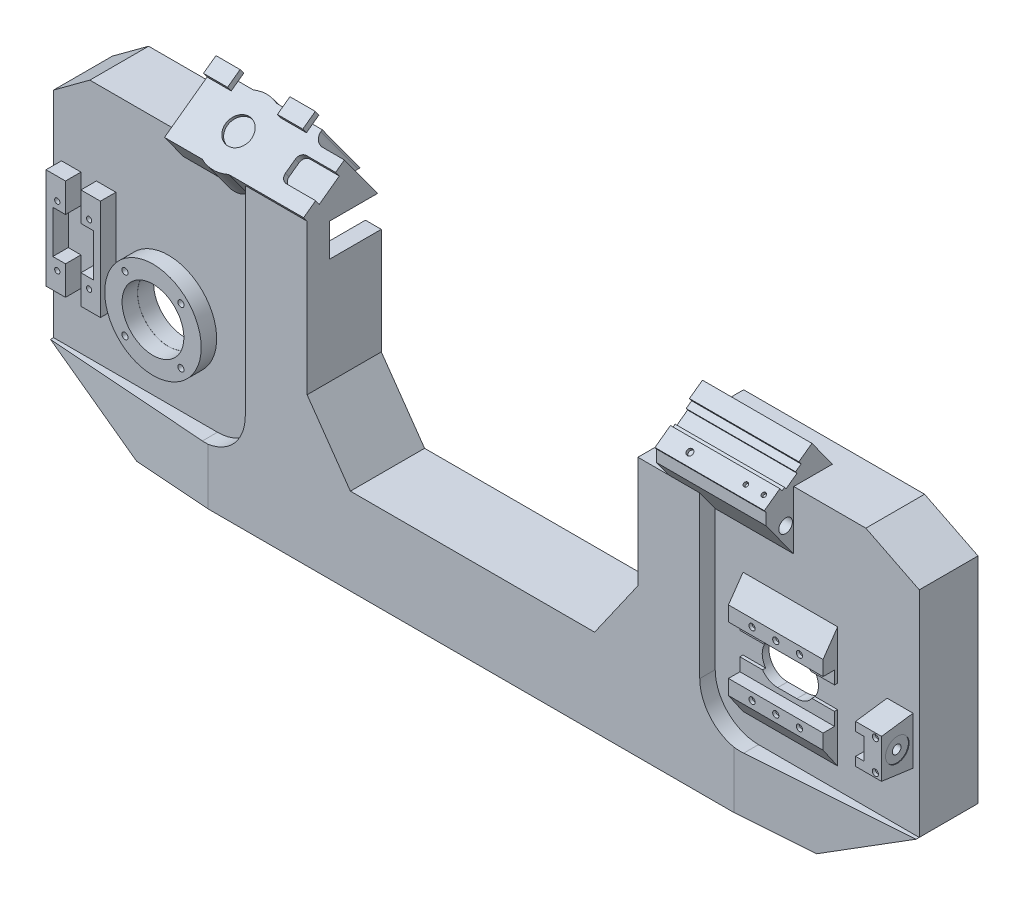
from build123d import *

# Parameters (mm, degrees)
ESQUISSE1_W                    = 1400
ESQUISSE1_H                    = 480
BOSS_EXTRU_1_DEPTH             = 95
ESQUISSE2_R                    = 78
ESQUISSE2_R_2                  = 50
BOSS_EXTRU_2_DEPTH             = 25
ESQUISSE4_R                    = 49.845
ENL_V_MAT_EXTRU_2_DEPTH        = 747.073052723
BOSS_EXTRU_3_DEPTH             = 25
CONG_1_R                       = 70
BOSS_EXTRU_4_DEPTH             = 25
ENL_V_MAT_EXTRU_5_DEPTH        = 748.063167972
ESQUISSE12_OUTSIDE_W           = 1699.17
ESQUISSE12_OUTSIDE_H           = 419.17
ENL_V_MAT_EXTRU_6_DEPTH        = 140
ENL_V_MAT_EXTRU_11_DEPTH       = 150
ESQUISSE14_W                   = 51
ESQUISSE14_H                   = 60
ENL_V_MAT_EXTRU_12_DEPTH       = 748.063167972
BOSS_EXTRU_18_START            = 415
BOSS_EXTRU_18_DEPTH            = 153
ESQUISSE31_W                   = 177
ESQUISSE31_H                   = 114
BOSS_EXTRU_19_DEPTH            = 150
ENL_V_MAT_EXTRU_19_DEPTH       = 207
ESQUISSE35_R                   = 11
ENL_V_MAT_EXTRU_20_DEPTH       = 87
ESQUISSE38_W                   = 225
ESQUISSE38_H                   = 99
BOSS_EXTRU_20_DEPTH            = 157
ESQUISSE39_W                   = 57
ESQUISSE39_H                   = 40
ENL_V_MAT_EXTRU_21_DEPTH       = 10
CONG_3_R                       = 10
ESQUISSE40_R                   = 53.5
BOSS_EXTRU_21_DEPTH            = 80
ESQUISSE42_R                   = 21
ENL_V_MAT_EXTRU_22_DEPTH       = 5
ESQUISSE43_W                   = 39
ESQUISSE43_H                   = 25
ESQUISSE43_W_2                 = 41
BOSS_EXTRU_22_DEPTH            = 10
ESQUISSE44_W                   = 50
ESQUISSE44_H                   = 17.5
ENL_V_MAT_EXTRU_23_DEPTH       = 183
CONG_4_R                       = 15
BOSS_EXTRU_23_START            = 690
BOSS_EXTRU_23_DEPTH            = 42
ENL_V_MAT_EXTRU_24_DEPTH       = 786.292239047
ENL_V_MAT_EXTRU_24_DEPTH_BACK  = 786.292239047
ENL_V_MAT_EXTRU_25_DEPTH       = 790.412383168
ENL_V_MAT_EXTRU_25_DEPTH_BACK  = 790.412383168
ESQUISSE87_R                   = 4.25
ESQUISSE87_R_2                 = 5
ESQUISSE89_R                   = 10.5
ENL_V_MAT_EXTRU_26_DEPTH       = 14
ESQUISSE90_R                   = 7
ENL_V_MAT_EXTRU_27_DEPTH       = 13
ESQUISSE93_W                   = 13.39
ESQUISSE93_H                   = 34.8
ENL_V_MAT_EXTRU_28_DEPTH       = 51
ESQUISSE94_R                   = 19
ENL_V_MAT_EXTRU_30_DEPTH       = 1
ESQUISSE96_R                   = 7
ENL_V_MAT_EXTRU_31_DEPTH       = 51
ENL_V_START                    = -84
ENL_V_MAT_EXTRU_32_OUTLINE_R   = 49.845
ENL_V_MAT_EXTRU_32_OUTLINE_R_2 = 5
ENL_V_MAT_EXTRU_32_OUTLINE_R_3 = 4.25
ENL_V_MAT_EXTRU_32_DEPTH       = 130.745344737
ESQUISSE122_W                  = 327.594526889
ESQUISSE122_H                  = 234.825077034
ESQUISSE122_R                  = 10.5
BOSS_EXTRU_25_DEPTH            = 15
ESQUISSE123_R                  = 49.845
ENL_V_MAT_EXTRU_33_DEPTH       = 781.359248616
ENL_V_MAT_EXTRU_34_DEPTH       = 15
ESQUISSE127_W                  = 45.95991567
ESQUISSE127_H                  = 52.348834678
ENL_V_MAT_EXTRU_36_DEPTH       = 1445.535877266
ESQUISSE36_R                   = 5
ESQUISSE36_R_2                 = 3.5
ENL_V_MAT_EXTRU_37_DEPTH       = 5
ESQUISSE128_R                  = 5
ENL_V_MAT_EXTRU_38_DEPTH       = 5
ESQUISSE129_R                  = 5
ENL_V_MAT_EXTRU_39_DEPTH       = 5


# Read off the part's stored shape, not the designer's step: Enlèv. mat.-Extru.32
with BuildPart() as part:
    # Esquisse1 → Boss.-Extru.1 (new body)
    with BuildSketch(Plane.XY):
        Rectangle(ESQUISSE1_W, ESQUISSE1_H)
    extrude(amount=BOSS_EXTRU_1_DEPTH)

    # Esquisse2 → Boss.-Extru.2 (add)
    with BuildSketch(Plane.XY.offset(95)):
        with Locations(Location((-514.266451246, -19.59, 0), (0, 0, 180))):
            Circle(ESQUISSE2_R)
        with Locations((-514.266451246, -19.59)):
            Circle(ESQUISSE2_R_2, mode=Mode.SUBTRACT)
    extrude(amount=BOSS_EXTRU_2_DEPTH)

    # Esquisse4 → Enlèv. mat.-Extru.2 (cut, through all)
    with BuildSketch(Plane.XY.offset(95)):
        with Locations((-514.266451246, -19.59)):
            Circle(ESQUISSE4_R)
    extrude(amount=-ENL_V_MAT_EXTRU_2_DEPTH, mode=Mode.SUBTRACT)

    # Esquisse3 → Boss.-Extru.3 (add)
    with BuildSketch(Plane.XY.offset(95)):
        Polygon((-700, -150), (-549.916689802, -240), (549.916689802, -240), (700, -150), (550, -150), (370, -150), (370, 180), (270, 180), (270, 0), (200, -100), (-195, -100), (-265, 0), (-265, 243.060438862), (-365, 243.060438862), (-365, -150), (-550, -150), align=None)
    extrude(amount=BOSS_EXTRU_3_DEPTH)

    # Congé1
    cong_1_edges = [part.edges().sort_by_distance(p)[0] for p in [
        (-365, -150, 107.5),
        (370, -150, 107.5),
    ]]
    fillet(cong_1_edges, radius=CONG_1_R)

    # Esquisse5 → Boss.-Extru.4 (add)
    with BuildSketch(Plane.XY.offset(95)):
        Polygon((-687.266451246, 104), (-655.766451246, 104), (-655.766451246, 57), (-676.266451246, 57), (-676.266451246, -12), (-655.766451246, -12), (-655.766451246, -59), (-687.266451246, -59), align=None)
        Polygon((-630.766451246, -12), (-630.766451246, -59), (-599.266451246, -59), (-599.266451246, 104), (-630.766451246, 104), (-630.766451246, 57), (-610.266451246, 57), (-610.266451246, -12), align=None)
    extrude(amount=BOSS_EXTRU_4_DEPTH)

    # Esquisse10 → Enlèv. mat.-Extru.5 (cut, through all)
    with BuildSketch(Plane.XY.offset(95)):
        Polygon((-265, 0), (-265, 240), (270, 240), (270, 0), (200, -100), (-195, -100), align=None)
        Polygon((-700, -150), (-700, -240), (-549.916689802, -240), align=None)
        Polygon((549.916689802, -240), (700, -150), (700, -240), align=None)
    extrude(amount=-ENL_V_MAT_EXTRU_5_DEPTH, mode=Mode.SUBTRACT)

    # Esquisse12 outside → Enlèv. mat.-Extru.6 (cut)
    with BuildSketch(Plane.XZ.offset(240)):
        with Locations((0, 60)):
            Rectangle(ESQUISSE12_OUTSIDE_W, ESQUISSE12_OUTSIDE_H)
        Polygon((-425, 120), (425, 120), (700, 100), (700, 0), (-700, 0), (-700, 100), align=None, mode=Mode.SUBTRACT)
    extrude(amount=-ENL_V_MAT_EXTRU_6_DEPTH, mode=Mode.SUBTRACT)

    # Esquisse13 → Enlèv. mat.-Extru.11 (cut)
    with BuildSketch(Plane.XY.offset(95)):
        Polygon((-700, 196.779981556), (-641.34385788, 240), (-700, 240), align=None)
        Polygon((613.644621493, 240), (700, 196.779981556), (700, 240), align=None)
    extrude(amount=-ENL_V_MAT_EXTRU_11_DEPTH, mode=Mode.SUBTRACT)

    # Esquisse14 → Enlèv. mat.-Extru.12 (cut, through all)
    with BuildSketch(Plane.XY.offset(95)):
        with Locations((295.5, 210)):
            Rectangle(ESQUISSE14_W, ESQUISSE14_H)
    extrude(amount=-ENL_V_MAT_EXTRU_12_DEPTH, mode=Mode.SUBTRACT)

    # Esquisse26 → Boss.-Extru.18 (add)
    with BuildSketch(Plane(origin=(0, 0, 0), x_dir=(0, 0, -1), z_dir=(1, 0, 0)).offset(BOSS_EXTRU_18_START)):
        Polygon((-95, -116), (-95, -69), (-95, -37), (-100, -37), (-100, -58), (-118.558437979, -58), (-118.558437979, -82), align=None)
        Polygon((-100, 0), (-95, 0), (-95, 32), (-95, 79), (-118.558437979, 45), (-118.558437979, 21), (-100, 21), align=None)
    extrude(amount=BOSS_EXTRU_18_DEPTH)

    # Esquisse31 → Boss.-Extru.19 (add)
    with BuildSketch(Plane(origin=(0, 96.881355802, 70.388425161), x_dir=(-1, 0, 0), z_dir=(0, 0.8090169943749487, 0.5877852522924715))):
        with Locations((-408.5, -65.719306088)):
            Rectangle(ESQUISSE31_W, ESQUISSE31_H)
    extrude(amount=BOSS_EXTRU_19_DEPTH)

    # Esquisse34 → Enlèv. mat.-Extru.19 (cut)
    with BuildSketch(Plane(origin=(497, 0, 0), x_dir=(0, 0, -1), z_dir=(1, 0, 0))):
        Polygon((-59.274208842, 290.366503248), (-65.61049483, 285.762922008), (-32.361785786, 240), (-22.680802245, 240), align=None)
        Polygon((-86.644936684, 270.480505448), (-117.38758247, 248.144665861), (-113.860870956, 243.290563895), (-109.815785985, 246.229490156), (-107.464644975, 242.993422179), (-89.666271099, 255.924697729), (-92.017412108, 259.160765707), (-83.11822517, 265.626403482), align=None)
        Polygon((-151.502146201, 223.358984487), (-140.115968287, 207.687255063), (-140.115968287, 226.687255063), (-142.467109296, 229.92332304), align=None)
    extrude(amount=-ENL_V_MAT_EXTRU_19_DEPTH, mode=Mode.SUBTRACT)

    # Esquisse35 → Enlèv. mat.-Extru.20 (cut)
    with BuildSketch(Plane(origin=(497, 0, 0), x_dir=(0, 0, -1), z_dir=(1, 0, 0))):
        with Locations((-108.107778442, 191.590451988)):
            Circle(ESQUISSE35_R)
    extrude(amount=-ENL_V_MAT_EXTRU_20_DEPTH, mode=Mode.SUBTRACT)

    # Esquisse38 → Boss.-Extru.20 (add)
    with BuildSketch(Plane(origin=(0, 96.881355802, 70.388425161), x_dir=(-1, 0, 0), z_dir=(0, 0.8090169943749487, 0.5877852522924715))):
        with Locations((377.5, -95.285302054)):
            Rectangle(ESQUISSE38_W, ESQUISSE38_H)
    extrude(amount=BOSS_EXTRU_20_DEPTH)

    # Esquisse39 → Enlèv. mat.-Extru.21 (cut)
    with BuildSketch(Plane(origin=(0, 223.897023919, 162.670709771), x_dir=(1, 0, 0), z_dir=(0, 0.8090169943749486, 0.5877852522924716))):
        with Locations((-293.5, 89.785302054)):
            Rectangle(ESQUISSE39_W, ESQUISSE39_H)
    extrude(amount=-ENL_V_MAT_EXTRU_21_DEPTH, mode=Mode.SUBTRACT)

    # Congé3
    cong_3_edges = [part.edges().sort_by_distance(p)[0] for p in [
        (-322, 260.870710321, 103.27428819),
        (-322, 284.382120413, 70.913608415),
    ]]
    fillet(cong_3_edges, radius=CONG_3_R)

    # Esquisse40 → Boss.-Extru.21 (add)
    with BuildSketch(Plane(origin=(0, 223.897023919, 162.670709771), x_dir=(1, 0, 0), z_dir=(0, 0.8090169943749486, 0.5877852522924716))):
        with Locations((-407.5, 94.785302054)):
            Circle(ESQUISSE40_R)
    extrude(amount=-BOSS_EXTRU_21_DEPTH)

    # Esquisse42 → Enlèv. mat.-Extru.22 (cut)
    with BuildSketch(Plane(origin=(0, 223.897023919, 162.670709771), x_dir=(1, 0, 0), z_dir=(0, 0.8090169943749486, 0.5877852522924716))):
        with Locations(Location((-410, 94.785302054, 0), (0, 0, 270))):
            Circle(ESQUISSE42_R)
    extrude(amount=-ENL_V_MAT_EXTRU_22_DEPTH, mode=Mode.SUBTRACT)

    # Esquisse43 → Boss.-Extru.22 (add)
    with BuildSketch(Plane(origin=(0, 223.897023919, 162.670709771), x_dir=(1, 0, 0), z_dir=(0, 0.8090169943749486, 0.5877852522924716))):
        with Locations((-470.5, 143.464401973)):
            Rectangle(ESQUISSE43_W, ESQUISSE43_H)
        with Locations((-351.187451291, 145.069499094)):
            Rectangle(ESQUISSE43_W_2, ESQUISSE43_H)
    extrude(amount=BOSS_EXTRU_22_DEPTH)

    # Esquisse44 → Enlèv. mat.-Extru.23 (cut)
    with BuildSketch(Plane(origin=(0, 223.897023919, 162.670709771), x_dir=(1, 0, 0), z_dir=(0, 0.8090169943749486, 0.5877852522924716))):
        with Locations((-290, 136.035302054)):
            Rectangle(ESQUISSE44_W, ESQUISSE44_H)
    extrude(amount=-ENL_V_MAT_EXTRU_23_DEPTH, mode=Mode.SUBTRACT)

    # Congé4
    cong_4_edges = [part.edges().sort_by_distance(p)[0] for p in [
        (-315, 235.205613241, 13.55359497),
    ]]
    fillet(cong_4_edges, radius=CONG_4_R)

    # Esquisse51 → Boss.-Extru.23 (add)
    with BuildSketch(Plane(origin=(0, 0, 0), x_dir=(0, 0, -1), z_dir=(1, 0, 0)).offset(BOSS_EXTRU_23_START)):
        Polygon((-146, 12), (-146, -51), (-95, -58), (-95, 19), align=None)
    extrude(amount=-BOSS_EXTRU_23_DEPTH)

    # Esquisse28 → Enlèv. mat.-Extru.24 (cut, two sides: drawn at the far end of the back side and taken through both)
    with BuildSketch(Plane.XY.offset(-ENL_V_MAT_EXTRU_24_DEPTH_BACK)):
        with BuildLine():
            Line((476, 10.41), (507, 10.41))
            ThreePointArc((507, 10.41), (537, -19.59), (507, -49.59))
            Line((507, -49.59), (476, -49.59))
            ThreePointArc((476, -49.59), (446, -19.59), (476, 10.41))
        make_face()
    extrude(amount=ENL_V_MAT_EXTRU_24_DEPTH + ENL_V_MAT_EXTRU_24_DEPTH_BACK, mode=Mode.SUBTRACT)

    # Esquisse87 → Enlèv. mat.-Extru.25 (cut, two sides: drawn at the far end of the back side and taken through both)
    with BuildSketch(Plane.XY.offset(120).offset(-ENL_V_MAT_EXTRU_25_DEPTH_BACK)):
        with Locations((-617.516451246, 69.25)):
            Circle(ESQUISSE87_R)
        with Locations((-617.516451246, -28.25)):
            Circle(ESQUISSE87_R)
        with Locations(Location((-669.016451246, 69.25, 0), (0, 0, 180))):
            Circle(ESQUISSE87_R)
        with Locations(Location((-469.01161725, 25.664833996, 0), (0, 0, 180))):
            Circle(ESQUISSE87_R_2)
        with Locations((-469.01161725, -64.844833996)):
            Circle(ESQUISSE87_R_2)
        with Locations((-559.521285242, 25.664833996)):
            Circle(ESQUISSE87_R_2)
        with Locations(Location((-559.521285242, -64.844833996, 0), (0, 0, 180))):
            Circle(ESQUISSE87_R_2)
        with Locations(Location((-669.016451246, -28.25, 0), (0, 0, 180))):
            Circle(ESQUISSE87_R)
    extrude(amount=ENL_V_MAT_EXTRU_25_DEPTH + ENL_V_MAT_EXTRU_25_DEPTH_BACK, mode=Mode.SUBTRACT)

    # Esquisse89 → Enlèv. mat.-Extru.26 (cut)
    with BuildSketch(Plane(origin=(0, 0, 0), x_dir=(-1, 0, 0), z_dir=(0, 0, -1))):
        with Locations((469.01161725, 25.664833996)):
            Circle(ESQUISSE89_R)
        with Locations(Location((559.521285242, 25.664833996, 0), (0, 0, 180))):
            Circle(ESQUISSE89_R)
        with Locations((559.521285242, -64.844833996)):
            Circle(ESQUISSE89_R)
        with Locations(Location((469.01161725, -64.844833996, 0), (0, 0, 180))):
            Circle(ESQUISSE89_R)
    extrude(amount=-ENL_V_MAT_EXTRU_26_DEPTH, mode=Mode.SUBTRACT)

    # Esquisse90 → Enlèv. mat.-Extru.27 (cut)
    with BuildSketch(Plane(origin=(0, 0, 0), x_dir=(-1, 0, 0), z_dir=(0, 0, -1))):
        with Locations((617.516451246, -28.25)):
            Circle(ESQUISSE90_R)
        with Locations((617.516451246, 69.25)):
            Circle(ESQUISSE90_R)
        with Locations((669.016451246, 69.25)):
            Circle(ESQUISSE90_R)
        with Locations((669.016451246, -28.25)):
            Circle(ESQUISSE90_R)
    extrude(amount=-ENL_V_MAT_EXTRU_27_DEPTH, mode=Mode.SUBTRACT)

    # Esquisse93 → Enlèv. mat.-Extru.28 (cut)
    with BuildSketch(Plane.XY.offset(146)):
        with Locations((654.695, -19.5)):
            Rectangle(ESQUISSE93_W, ESQUISSE93_H)
    extrude(amount=-ENL_V_MAT_EXTRU_28_DEPTH, mode=Mode.SUBTRACT)

    # Esquisse94 → Enlèv. mat.-Extru.30 (cut)
    with BuildSketch(Plane(origin=(690, 0, 0), x_dir=(0, 0, -1), z_dir=(1, 0, 0))):
        with Locations((-120.5, -19.5)):
            Circle(ESQUISSE94_R)
    extrude(amount=-ENL_V_MAT_EXTRU_30_DEPTH, mode=Mode.SUBTRACT)

    # Esquisse96 → Enlèv. mat.-Extru.31 (cut)
    with BuildSketch(Plane(origin=(690, 0, 0), x_dir=(0, 0, -1), z_dir=(1, 0, 0))):
        with Locations((-120.5, -19.5)):
            Circle(ESQUISSE96_R)
    extrude(amount=-ENL_V_MAT_EXTRU_31_DEPTH, mode=Mode.SUBTRACT)

    # Enlèv. mat.-Extru.32 outline → Enlèv. mat.-Extru.32 (cut)
    with BuildSketch(Plane(origin=(0, 0, 0), x_dir=(-1, 0, 0), z_dir=(0, 0, -1)).offset(ENL_V_START)):
        Polygon((-320, 225), (-610.100497351, 225), (-685, 187.513534861), (-685, -141.504718291), (-545.763908168, -225), (545.763908168, -225), (685, -141.504718291), (685, 189.200334278), (636.41440573, 225), (315, 225), (265, 225), (265, 171.697779183), (290.624113298, 171.697779183), (290.624113298, 148.021540161), (280, 148.021540161), (280, -4.728333462), (202.809833424, -115), (-207.809833424, -115), (-285, -4.728333462), (-285, 180), (-320, 180), align=None)
        with Locations((514.266451246, -19.59)):
            Circle(ENL_V_MAT_EXTRU_32_OUTLINE_R, mode=Mode.SUBTRACT)
        with BuildLine():
            Line((-507, 10.41), (-476, 10.41))
            ThreePointArc((-476, 10.41), (-446, -19.59), (-476, -49.59))
            Line((-476, -49.59), (-507, -49.59))
            ThreePointArc((-507, -49.59), (-537, -19.59), (-507, 10.41))
        make_face(mode=Mode.SUBTRACT)
        with Locations((469.01161725, 25.664833996)):
            Circle(ENL_V_MAT_EXTRU_32_OUTLINE_R_2, mode=Mode.SUBTRACT)
        with Locations((559.521285242, 25.664833996)):
            Circle(ENL_V_MAT_EXTRU_32_OUTLINE_R_2, mode=Mode.SUBTRACT)
        with Locations((617.516451246, 69.25)):
            Circle(ENL_V_MAT_EXTRU_32_OUTLINE_R_3, mode=Mode.SUBTRACT)
        with Locations((669.016451246, 69.25)):
            Circle(ENL_V_MAT_EXTRU_32_OUTLINE_R_3, mode=Mode.SUBTRACT)
        with Locations((669.016451246, -28.25)):
            Circle(ENL_V_MAT_EXTRU_32_OUTLINE_R_3, mode=Mode.SUBTRACT)
        with Locations((469.01161725, -64.844833996)):
            Circle(ENL_V_MAT_EXTRU_32_OUTLINE_R_2, mode=Mode.SUBTRACT)
        with Locations((559.521285242, -64.844833996)):
            Circle(ENL_V_MAT_EXTRU_32_OUTLINE_R_2, mode=Mode.SUBTRACT)
        with Locations((617.516451246, -28.25)):
            Circle(ENL_V_MAT_EXTRU_32_OUTLINE_R_3, mode=Mode.SUBTRACT)
    extrude(amount=ENL_V_MAT_EXTRU_32_DEPTH, mode=Mode.SUBTRACT)

    # Esquisse122 → Boss.-Extru.25 (add)
    with BuildSketch(Plane(origin=(0, 0, 84), x_dir=(-1, 0, 0), z_dir=(0, 0, -1))):
        with Locations((521.202736555, -2.132444983)):
            Rectangle(ESQUISSE122_W, ESQUISSE122_H)
        with Locations((469.01161725, 25.664833996)):
            Circle(ESQUISSE122_R, mode=Mode.SUBTRACT)
        with Locations((617.516451246, 69.25)):
            Circle(ESQUISSE122_R, mode=Mode.SUBTRACT)
        with Locations((559.521285242, 25.664833996)):
            Circle(ESQUISSE122_R, mode=Mode.SUBTRACT)
        with Locations((617.516451246, -28.25)):
            Circle(ESQUISSE122_R, mode=Mode.SUBTRACT)
        with Locations((669.016451246, 69.25)):
            Circle(ESQUISSE122_R, mode=Mode.SUBTRACT)
        with Locations((669.016451246, -28.25)):
            Circle(ESQUISSE122_R, mode=Mode.SUBTRACT)
        with Locations(Location((469.01161725, -64.844833996, 0), (0, 0, 180))):
            Circle(ESQUISSE122_R, mode=Mode.SUBTRACT)
        with Locations(Location((559.521285242, -64.844833996, 0), (0, 0, 180))):
            Circle(ESQUISSE122_R, mode=Mode.SUBTRACT)
    extrude(amount=BOSS_EXTRU_25_DEPTH)

    # Esquisse123 → Enlèv. mat.-Extru.33 (cut, through all)
    with BuildSketch(Plane.XY.offset(84)):
        with Locations((-514.266451246, -19.59)):
            Circle(ESQUISSE123_R)
    extrude(amount=-ENL_V_MAT_EXTRU_33_DEPTH, mode=Mode.SUBTRACT)

    # Esquisse124 → Enlèv. mat.-Extru.34 (cut)
    with BuildSketch(Plane(origin=(0, 0, 69), x_dir=(-1, 0, 0), z_dir=(0, 0, -1))):
        with BuildLine():
            ThreePointArc((542.17178234, 47.86585591), (514.266451246, 53.41), (486.361120153, 47.86585591))
            ThreePointArc((486.361120153, 47.86585591), (481.485028052, 36.108997238), (493.241886724, 31.232905138))
            ThreePointArc((493.241886724, 31.232905138), (514.266451246, 35.41), (535.291015769, 31.232905138))
            ThreePointArc((535.291015769, 31.232905138), (547.04787444, 36.108997238), (542.17178234, 47.86585591))
        make_face()
        with BuildLine():
            ThreePointArc((542.17178234, -87.04585591), (514.266451246, -92.59), (486.361120153, -87.04585591))
            ThreePointArc((486.361120153, -87.04585591), (481.485028052, -75.288997238), (493.241886724, -70.412905138))
            ThreePointArc((493.241886724, -70.412905138), (514.266451246, -74.59), (535.291015769, -70.412905138))
            ThreePointArc((535.291015769, -70.412905138), (547.04787444, -75.288997238), (542.17178234, -87.04585591))
        make_face()
        with BuildLine():
            ThreePointArc((447.272621746, 8.124198689), (441.766451246, -19.59), (447.272621746, -47.304198689))
            ThreePointArc((447.272621746, -47.304198689), (458.376321603, -51.909396784), (462.981519698, -40.805696927))
            ThreePointArc((462.981519698, -40.805696927), (458.766451246, -19.59), (462.981519698, 1.625696927))
            ThreePointArc((462.981519698, 1.625696927), (458.376321603, 12.729396784), (447.272621746, 8.124198689))
        make_face()
        with BuildLine():
            ThreePointArc((581.260280746, 8.124198689), (586.766451246, -19.59), (581.260280746, -47.304198689))
            ThreePointArc((581.260280746, -47.304198689), (570.156580889, -51.909396784), (565.551382794, -40.805696927))
            ThreePointArc((565.551382794, -40.805696927), (569.766451246, -19.59), (565.551382794, 1.625696927))
            ThreePointArc((565.551382794, 1.625696927), (570.156580889, 12.729396784), (581.260280746, 8.124198689))
        make_face()
    extrude(amount=-ENL_V_MAT_EXTRU_34_DEPTH, mode=Mode.SUBTRACT)

    # Esquisse127 → Enlèv. mat.-Extru.36 (cut, through all)
    with BuildSketch(Plane(origin=(700, 0, 0), x_dir=(0, 0, -1), z_dir=(1, 0, 0))):
        with Locations((22.979957835, 157.580927611)):
            Rectangle(ESQUISSE127_W, ESQUISSE127_H)
    extrude(amount=-ENL_V_MAT_EXTRU_36_DEPTH, mode=Mode.SUBTRACT)

    # Esquisse36 → Enlèv. mat.-Extru.37 (cut)
    with BuildSketch(Plane(origin=(0, 218.233904958, 158.556213005), x_dir=(1, 0, 0), z_dir=(0, 0.8090169943749487, 0.5877852522924715))):
        with Locations(Location((364, 35.387225881, 0), (0, 0, 270))):
            Circle(ESQUISSE36_R)
        with Locations(Location((454.5, 35.387225881, 0), (0, 0, 270))):
            Circle(ESQUISSE36_R_2)
        with Locations(Location((483.5, 35.387225881, 0), (0, 0, 270))):
            Circle(ESQUISSE36_R_2)
    extrude(amount=-ENL_V_MAT_EXTRU_37_DEPTH, mode=Mode.SUBTRACT)

    # Esquisse128 → Enlèv. mat.-Extru.38 (cut)
    with BuildSketch(Plane.XY.offset(118.558437979)):
        with Locations((491.5, 33)):
            Circle(ESQUISSE128_R)
        with Locations((453.25, 33)):
            Circle(ESQUISSE128_R)
        with Locations((529.75, 33)):
            Circle(ESQUISSE128_R)
        with Locations(Location((529.75, -70, 0), (0, 0, 180))):
            Circle(ESQUISSE128_R)
        with Locations(Location((491.5, -70, 0), (0, 0, 180))):
            Circle(ESQUISSE128_R)
        with Locations(Location((453.25, -70, 0), (0, 0, 180))):
            Circle(ESQUISSE128_R)
    extrude(amount=-ENL_V_MAT_EXTRU_38_DEPTH, mode=Mode.SUBTRACT)

    # Esquisse129 → Enlèv. mat.-Extru.39 (cut)
    with BuildSketch(Plane.XY.offset(146)):
        with Locations((680, 5.017644345)):
            Circle(ESQUISSE129_R)
        with Locations((680, -43.728185797)):
            Circle(ESQUISSE129_R)
    extrude(amount=-ENL_V_MAT_EXTRU_39_DEPTH, mode=Mode.SUBTRACT)


solid = part.part
